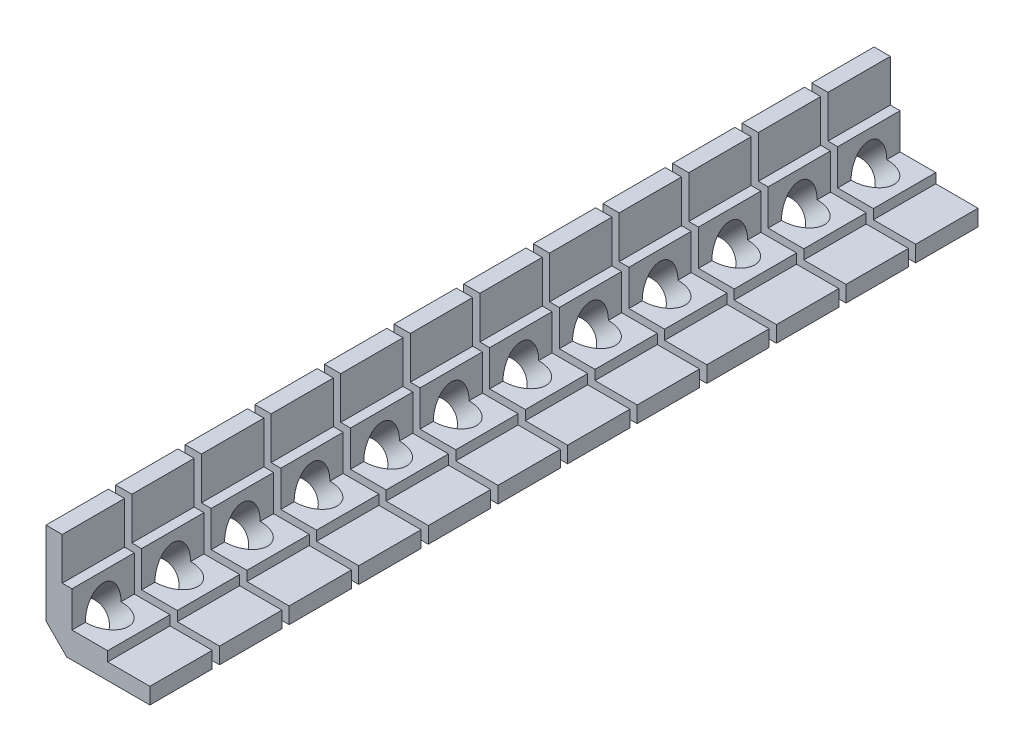
from build123d import *

# Parameters (mm, degrees)
CLAMP_BASE_START       = 12.523926183
CLAMP_BASE_OUTLINE_W   = 3.96875
CLAMP_BASE_OUTLINE_H   = 15.24
CLAMP_BASE_DEPTH       = 12.876073817
CLAMP_BASE_2_OUTLINE_W = 10.31875
CLAMP_BASE_2_OUTLINE_H = 15.24
CLAMP_BASE_2_DEPTH     = 3.96875
CLAMP_BASE_3_OUTLINE_W = 2.38125
CLAMP_BASE_3_OUTLINE_H = 15.24
CLAMP_BASE_3_DEPTH     = 2.557323817
CLAMP_BASE_START_2     = -7.62
CLAMP_BASE_4_DEPTH     = 15.24
CLAMP_BASE_START_3     = 3.592102448
CLAMP_BASE_5_OUTLINE_R = 4.365625
CLAMP_BASE_5_DEPTH     = 9.753778773
LPATTERN1_COUNT        = 12
LPATTERN1_PITCH        = 17.018


with BuildPart() as part:
    # clamp-base: read off the stored shape, not the designer's step
    # clamp-base outline → clamp-base (new body)
    with BuildSketch(Plane(origin=(0, 0, 0), x_dir=(1, 0, 0), z_dir=(0, 1, 0)).offset(CLAMP_BASE_START)):
        with Locations((1.984375, 0)):
            Rectangle(CLAMP_BASE_OUTLINE_W, CLAMP_BASE_OUTLINE_H)
    extrude(amount=CLAMP_BASE_DEPTH)



with BuildPart() as body_2:
    # clamp-base 2 outline → clamp-base 2 (new body)
    with BuildSketch(Plane(origin=(0, 0, 0), x_dir=(1, 0, 0), z_dir=(0, 1, 0))):
        with Locations((20.240625, 0)):
            Rectangle(CLAMP_BASE_2_OUTLINE_W, CLAMP_BASE_2_OUTLINE_H)
    extrude(amount=CLAMP_BASE_2_DEPTH)


with BuildPart() as body_3:
    # clamp-base 3 outline → clamp-base 3 (new body)
    with BuildSketch(Plane(origin=(0, 0, 0), x_dir=(1, 0, 0), z_dir=(0, 1, 0)).offset(CLAMP_BASE_START)):
        with Locations((5.159375, 0)):
            Rectangle(CLAMP_BASE_3_OUTLINE_W, CLAMP_BASE_3_OUTLINE_H)
    extrude(amount=CLAMP_BASE_3_DEPTH)


with BuildPart() as part_1:
    add(part.part)

    add(body_2.part)  # clamp-base 4 merges body 2

    add(body_3.part)  # clamp-base 4 merges body 3
    # clamp-base 4 outline → clamp-base 4 (add)
    with BuildSketch(Plane.XY.offset(CLAMP_BASE_START_2)):
        Polygon((0, 5.08), (5.08, 0), (15.08125, 0), (15.08125, 6.35), (6.35, 6.35), (6.35, 12.523926183), (0, 12.523926183), align=None)
    extrude(amount=CLAMP_BASE_4_DEPTH)

    # clamp-base 5 outline → clamp-base 5 (cut)
    with BuildSketch(Plane(origin=(0, 0, 0), x_dir=(0.707106781186546, -0.707106781186549, 0), z_dir=(0.707106781186549, 0.707106781186546, 0)).offset(CLAMP_BASE_START_3)):
        Circle(CLAMP_BASE_5_OUTLINE_R)
    extrude(amount=CLAMP_BASE_5_DEPTH, mode=Mode.SUBTRACT)


with BuildPart() as lpattern1_1:
    # LPattern1: pattern copy
    add(part_1.part.moved(Location(Vector(0, 0, 1) * (1 * LPATTERN1_PITCH))))


with BuildPart() as lpattern1_2:
    # LPattern1: pattern copy
    add(part_1.part.moved(Location(Vector(0, 0, 1) * (2 * LPATTERN1_PITCH))))


with BuildPart() as lpattern1_3:
    # LPattern1: pattern copy
    add(part_1.part.moved(Location(Vector(0, 0, 1) * (3 * LPATTERN1_PITCH))))


with BuildPart() as lpattern1_4:
    # LPattern1: pattern copy
    add(part_1.part.moved(Location(Vector(0, 0, 1) * (4 * LPATTERN1_PITCH))))


with BuildPart() as lpattern1_5:
    # LPattern1: pattern copy
    add(part_1.part.moved(Location(Vector(0, 0, 1) * (5 * LPATTERN1_PITCH))))


with BuildPart() as lpattern1_6:
    # LPattern1: pattern copy
    add(part_1.part.moved(Location(Vector(0, 0, 1) * (6 * LPATTERN1_PITCH))))


with BuildPart() as lpattern1_7:
    # LPattern1: pattern copy
    add(part_1.part.moved(Location(Vector(0, 0, 1) * (7 * LPATTERN1_PITCH))))


with BuildPart() as lpattern1_8:
    # LPattern1: pattern copy
    add(part_1.part.moved(Location(Vector(0, 0, 1) * (8 * LPATTERN1_PITCH))))


with BuildPart() as lpattern1_9:
    # LPattern1: pattern copy
    add(part_1.part.moved(Location(Vector(0, 0, 1) * (9 * LPATTERN1_PITCH))))


with BuildPart() as lpattern1_10:
    # LPattern1: pattern copy
    add(part_1.part.moved(Location(Vector(0, 0, 1) * (10 * LPATTERN1_PITCH))))


with BuildPart() as lpattern1_11:
    # LPattern1: pattern copy
    add(part_1.part.moved(Location(Vector(0, 0, 1) * (11 * LPATTERN1_PITCH))))


solid = Compound([part_1.part, lpattern1_1.part, lpattern1_2.part, lpattern1_3.part, lpattern1_4.part, lpattern1_5.part, lpattern1_6.part, lpattern1_7.part, lpattern1_8.part, lpattern1_9.part, lpattern1_10.part, lpattern1_11.part])
